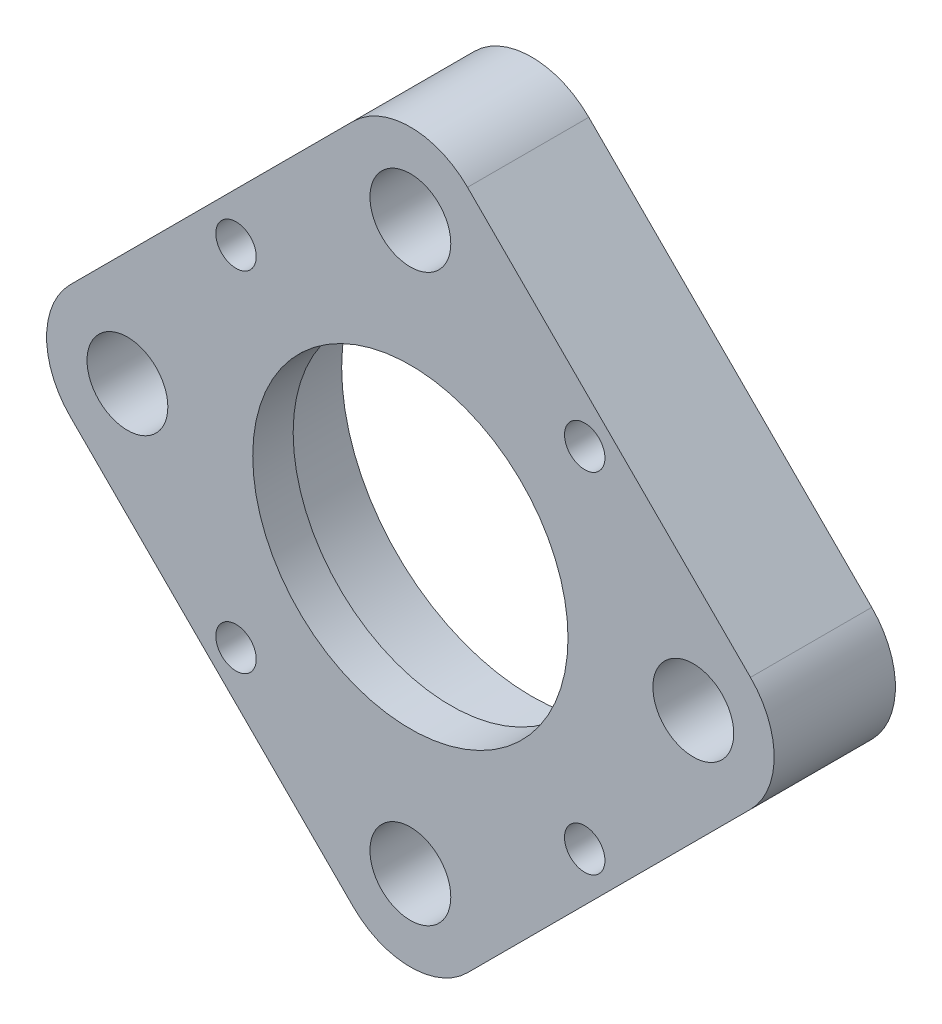
from build123d import *

# Parameters (mm, degrees)
SZKIC1_R                    = 35
SZKIC1_R_2                  = 19.5
DODANIE_WYCI_GNI_CIE3_DEPTH = 5
DODANIE_WYCI_GNI_CIE5_START = 10
SZKIC4_R                    = 35
SZKIC4_R_2                  = 23.5
DODANIE_WYCI_GNI_CIE5_DEPTH = 10
DODANIE_WYCI_GNI_CIE6_DEPTH = 15
OTWORY_USTALAJ_CE_10_0MM1_D = 10
OTWORY_USTALAJ_CE_5_0MM3_D  = 5
DODANIE_WYCI_GNI_CIE7_DEPTH = 15
SZKIC28_R                   = 52.509364788
WYTNIJ_WYCI_GNI_CIE6_DEPTH  = 15


with BuildPart() as part:
    # Szkic1 → Dodanie-wyciągnięcie3 (new body)
    with BuildSketch(Plane.XY):
        Circle(SZKIC1_R)
        Circle(SZKIC1_R_2, mode=Mode.SUBTRACT)
    extrude(amount=DODANIE_WYCI_GNI_CIE3_DEPTH)

    # Szkic4 → Dodanie-wyciągnięcie5 (add)
    with BuildSketch(Plane(origin=(0, 0, 0), x_dir=(-1, 0, 0), z_dir=(0, 0, -1)).offset(DODANIE_WYCI_GNI_CIE5_START)):
        Circle(SZKIC4_R)
        Circle(SZKIC4_R_2, mode=Mode.SUBTRACT)
    extrude(amount=-DODANIE_WYCI_GNI_CIE5_DEPTH)

    # Szkic13 → Dodanie-wyciągnięcie6 (add)
    with BuildSketch(Plane(origin=(0, 0, -10), x_dir=(-1, 0, 0), z_dir=(0, 0, -1))):
        with BuildLine():
            ThreePointArc((9.897433186, 33.571428571), (0, 45), (-9.897433186, 33.571428571))
            ThreePointArc((-9.897433186, 33.571428571), (0, 35), (9.897433186, 33.571428571))
        make_face()
        with BuildLine():
            ThreePointArc((-33.571428571, -9.897433186), (-35, 0), (-33.571428571, 9.897433186))
            ThreePointArc((-33.571428571, 9.897433186), (-45, 0), (-33.571428571, -9.897433186))
        make_face()
        with BuildLine():
            ThreePointArc((33.571428571, -9.897433186), (45, 0), (33.571428571, 9.897433186))
            ThreePointArc((33.571428571, 9.897433186), (35, 0), (33.571428571, -9.897433186))
        make_face()
        with BuildLine():
            ThreePointArc((-9.897433186, -33.571428571), (0, -45), (9.897433186, -33.571428571))
            ThreePointArc((9.897433186, -33.571428571), (0, -35), (-9.897433186, -33.571428571))
        make_face()
    extrude(amount=-DODANIE_WYCI_GNI_CIE6_DEPTH)

    # Otwory ustalające Ø10.0mm1 (through all)
    with Locations(Plane.XY.offset(5)):
        with Locations((0, 35), (0, -35), (-35, 0), (35, 0)):
            Hole(OTWORY_USTALAJ_CE_10_0MM1_D / 2)

    # Otwory ustalające Ø5.0mm3 (through all)
    with Locations(Plane.XY.offset(5)):
        with Locations((-21.566756826, 21.566756826), (21.566756826, 21.566756826), (21.566756826, -21.566756826), (-21.566756826, -21.566756826)):
            Hole(OTWORY_USTALAJ_CE_5_0MM3_D / 2)

    # Szkic27 → Dodanie-wyciągnięcie7 (add)
    with BuildSketch(Plane(origin=(0, 0, -10), x_dir=(-1, 0, 0), z_dir=(0, 0, -1))):
        with BuildLine():
            Line((27.531241216, -21.610894407), (42.071067812, -7.071067812))
            ThreePointArc((42.071067812, -7.071067812), (38.155396436, -9.48912395), (33.571428571, -9.897433186))
            ThreePointArc((33.571428571, -9.897433186), (31.107641461, -16.041029978), (27.531241216, -21.610894407))
        make_face()
        with BuildLine():
            ThreePointArc((33.571428571, 9.897433186), (38.155396436, 9.48912395), (42.071067812, 7.071067812))
            Line((42.071067812, 7.071067812), (27.531241216, 21.610894407))
            ThreePointArc((27.531241216, 21.610894407), (31.107641461, 16.041029978), (33.571428571, 9.897433186))
        make_face()
        with BuildLine():
            Line((7.071067812, -42.071067812), (21.610894407, -27.531241216))
            ThreePointArc((21.610894407, -27.531241216), (16.041029978, -31.107641461), (9.897433186, -33.571428571))
            ThreePointArc((9.897433186, -33.571428571), (9.48912395, -38.155396436), (7.071067812, -42.071067812))
        make_face()
        with BuildLine():
            ThreePointArc((9.897433186, 33.571428571), (16.041029978, 31.107641461), (21.610894407, 27.531241216))
            Line((21.610894407, 27.531241216), (7.071067812, 42.071067812))
            ThreePointArc((7.071067812, 42.071067812), (9.48912395, 38.155396436), (9.897433186, 33.571428571))
        make_face()
        with BuildLine():
            Line((-21.610894407, -27.531241216), (-7.071067812, -42.071067812))
            ThreePointArc((-7.071067812, -42.071067812), (-9.48912395, -38.155396436), (-9.897433186, -33.571428571))
            ThreePointArc((-9.897433186, -33.571428571), (-16.041029978, -31.107641461), (-21.610894407, -27.531241216))
        make_face()
        with BuildLine():
            ThreePointArc((-9.897433186, 33.571428571), (-9.48912395, 38.155396436), (-7.071067812, 42.071067812))
            Line((-7.071067812, 42.071067812), (-21.610894407, 27.531241216))
            ThreePointArc((-21.610894407, 27.531241216), (-16.041029978, 31.107641461), (-9.897433186, 33.571428571))
        make_face()
        with BuildLine():
            Line((-42.071067812, -7.071067812), (-27.531241216, -21.610894407))
            ThreePointArc((-27.531241216, -21.610894407), (-31.107641461, -16.041029978), (-33.571428571, -9.897433186))
            ThreePointArc((-33.571428571, -9.897433186), (-38.155396436, -9.48912395), (-42.071067812, -7.071067812))
        make_face()
        with BuildLine():
            ThreePointArc((-33.571428571, 9.897433186), (-31.107641461, 16.041029978), (-27.531241216, 21.610894407))
            Line((-27.531241216, 21.610894407), (-42.071067812, 7.071067812))
            ThreePointArc((-42.071067812, 7.071067812), (-38.155396436, 9.48912395), (-33.571428571, 9.897433186))
        make_face()
    extrude(amount=-DODANIE_WYCI_GNI_CIE7_DEPTH)

    # Szkic28 → Wytnij-wyciągnięcie6 (cut)
    with BuildSketch(Plane(origin=(0, 0, -10), x_dir=(-1, 0, 0), z_dir=(0, 0, -1))):
        Circle(SZKIC28_R)
        Polygon((0, -49.142135624), (-49.142135624, 0), (0, 49.142135624), (49.142135624, 0), align=None, mode=Mode.SUBTRACT)
    extrude(amount=-WYTNIJ_WYCI_GNI_CIE6_DEPTH, mode=Mode.SUBTRACT)


solid = part.part
